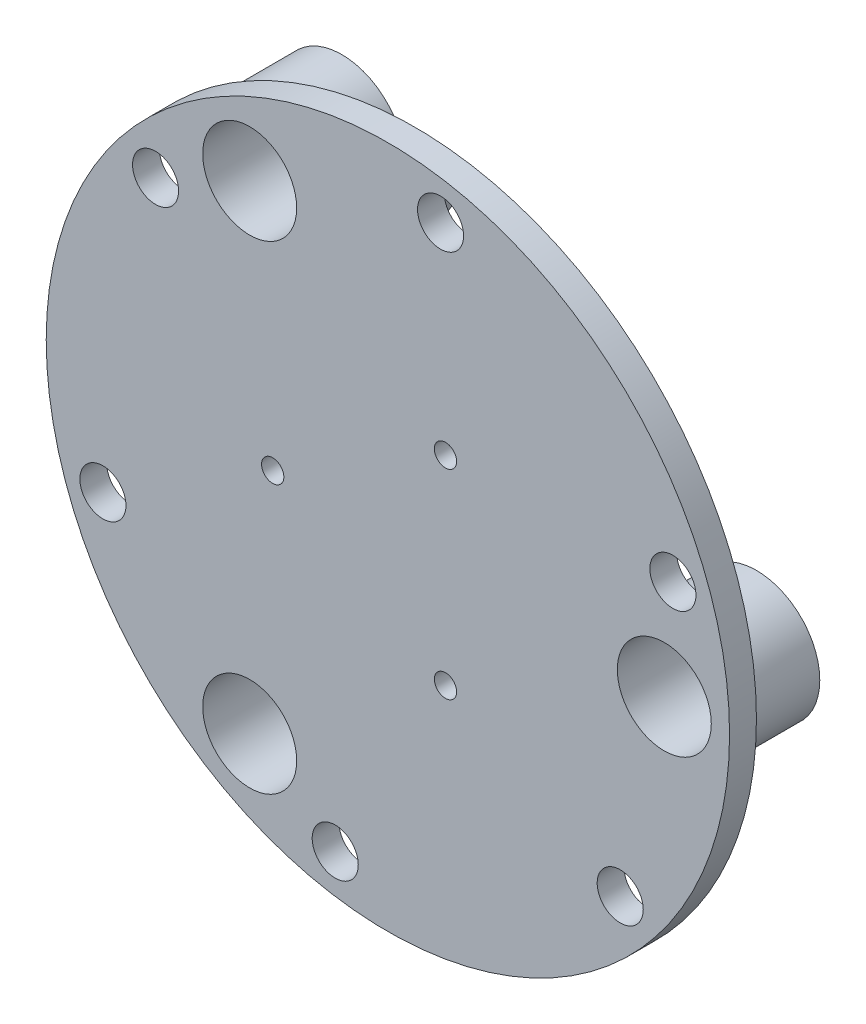
from build123d import *

# Parameters (mm, degrees)
F_01_START                                = 33.5
S01_JOINING_CENTRE_OF_FLOATING_Y_R        = 9
F_01_JOINING_CENTRE_OF_FLOATING_Y_DEPTH   = 3.5
F_02_START                                = 33.5
F_02_FLOATING_SPOKE_1_DEPTH               = 3.5
F_03_START                                = 33.5
F_03_FLOATING_SPOKE_2_DEPTH               = 3.5
F_04_START                                = 33.5
F_04_FLOATING_SPOKE_3_DEPTH               = 3.5
F_05_START                                = 33.5
F_05_MOVING_TENDON_TIE_WEB_1_DEPTH        = 3.5
F_06_START                                = 29.8
S06_TENDON_ANCHOR_BASE_1_R                = 4.2
F_06_TENDON_ANCHOR_BASE_1_DEPTH           = 3.7
F_07_START                                = 28
S07_TENDON_MOUTH_1_R                      = 3.15
F_07_TENDON_MOUTH_1_DEPTH                 = 1.8
F_08_START                                = 33.5
F_08_MOVING_TENDON_TIE_WEB_2_DEPTH        = 3.5
F_09_START                                = 29.8
S09_TENDON_ANCHOR_BASE_2_R                = 4.2
F_09_TENDON_ANCHOR_BASE_2_DEPTH           = 3.7
F_10_START                                = 28
S10_TENDON_MOUTH_2_R                      = 3.15
F_10_TENDON_MOUTH_2_DEPTH                 = 1.8
F_11_START                                = 33.5
F_11_MOVING_TENDON_TIE_WEB_3_DEPTH        = 3.5
F_12_START                                = 29.8
S12_TENDON_ANCHOR_BASE_3_R                = 4.2
F_12_TENDON_ANCHOR_BASE_3_DEPTH           = 3.7
F_13_START                                = 28
S13_TENDON_MOUTH_3_R                      = 3.15
F_13_TENDON_MOUTH_3_DEPTH                 = 1.8
F_14_START                                = 33.5
S14_JOINED_DRIVE_HOOP_R                   = 44.5
F_14_JOINED_DRIVE_HOOP_DEPTH              = 3.5
F_15_START                                = 25
S15_SLIDING_GUIDE_BARREL_1_R              = 8.25
F_15_SLIDING_GUIDE_BARREL_1_DEPTH         = 12
F_16_START                                = 25
S16_SLIDING_GUIDE_BARREL_2_R              = 8.25
F_16_SLIDING_GUIDE_BARREL_2_DEPTH         = 12
F_17_START                                = 25
S17_SLIDING_GUIDE_BARREL_3_R              = 8.25
F_17_SLIDING_GUIDE_BARREL_3_DEPTH         = 12
F_18_START                                = 24
S18_GUIDE_BUSHING_SEATS_R                 = 6.12
F_18_GUIDE_BUSHING_SEATS_DEPTH            = 14
F_19_START                                = 27.8
S19_THROUGH_TENDON_TIE_EYES_R             = 1.45
F_19_THROUGH_TENDON_TIE_EYES_DEPTH        = 10
F_20_START                                = -7.2
F_20_INTEGRAL_B1_FORK_CHEEK_L_DEPTH       = 3.6
F_21_START                                = 3.6
F_21_INTEGRAL_B1_FORK_CHEEK_R_DEPTH       = 3.6
F_22_START                                = -7.5
S22_B1_PIVOT_THROUGH_BOTH_CHEEKS_R        = 1.65
F_22_B1_PIVOT_THROUGH_BOTH_CHEEKS_DEPTH   = 15
F_23_START                                = -7.3
S23_B1_RECESSED_PIVOT_SCREW_HEAD_R        = 2.7
F_23_B1_RECESSED_PIVOT_SCREW_HEAD_DEPTH   = 1.5
F_24_START                                = -7.2
F_24_INTEGRAL_B2_FORK_CHEEK_L_DEPTH       = 3.6
F_25_START                                = 3.6
F_25_INTEGRAL_B2_FORK_CHEEK_R_DEPTH       = 3.6
F_26_START                                = -7.5
S26_B2_PIVOT_THROUGH_BOTH_CHEEKS_R        = 2.6
F_26_B2_PIVOT_THROUGH_BOTH_CHEEKS_DEPTH   = 15
F_27_START                                = -7.3
S27_B2_RECESSED_PIVOT_SCREW_HEAD_R        = 2.7
F_27_B2_RECESSED_PIVOT_SCREW_HEAD_DEPTH   = 1.5
F_28_START                                = -7.2
F_28_INTEGRAL_B3_FORK_CHEEK_L_DEPTH       = 3.6
F_29_START                                = 3.6
F_29_INTEGRAL_B3_FORK_CHEEK_R_DEPTH       = 3.6
F_30_START                                = -7.5
S30_B3_PIVOT_THROUGH_BOTH_CHEEKS_R        = 2.6
F_30_B3_PIVOT_THROUGH_BOTH_CHEEKS_DEPTH   = 15
F_31_START                                = -7.3
S31_B3_RECESSED_PIVOT_SCREW_HEAD_R        = 2.7
F_31_B3_RECESSED_PIVOT_SCREW_HEAD_DEPTH   = 1.5
CUT_EXTRUDE1_DEPTH                        = 74.425869509
CUT_EXTRUDE1_DEPTH_BACK                   = 16
SKETCH1_R                                 = 2.6
FORK_INNER_FACES_8_40_MM_LUG_CLEARANCE_BY = 0.6
FORK_INNER_FACES_8_40_MM_LUG_CLEAR_2_BY   = 0.6
FORK_INNER_FACES_8_40_MM_LUG_CLEAR_3_BY   = 0.6
FORK_INNER_FACES_8_40_MM_LUG_CLEAR_4_BY   = 0.6
FORK_INNER_FACES_8_40_MM_LUG_CLEAR_5_BY   = 0.6
FORK_INNER_FACES_8_40_MM_LUG_CLEAR_6_BY   = 0.6
SIX_START                                 = 37.1
SIX_6_MM_HOLES_ON_79_MM_PITCH_CIRCLE_R    = 3
SIX_LIGHTENING_HOLES_AT_60_DEGREES_DEPTH  = 3.7
CENTRAL_START                             = 30.55
CENTRAL_SIX_SIDED_RIB_JUNCTION_DEPTH      = 3
F_01_START_2                              = -4.12
S01_SWING_RELIEF_INSIDE_FORK_1_R          = 7.05
F_01_SWING_RELIEF_INSIDE_FORK_1_DEPTH     = 8.24
F_02_START_2                              = -4.12
S02_SWING_RELIEF_INSIDE_FORK_2_R          = 7.05
F_02_SWING_RELIEF_INSIDE_FORK_2_DEPTH     = 8.24
F_03_START_2                              = -4.12
S03_SWING_RELIEF_INSIDE_FORK_3_R          = 7.05
F_03_SWING_RELIEF_INSIDE_FORK_3_DEPTH     = 8.24


with BuildPart() as part:
    # S01 - Joining centre of floating Y → 01 - Joining centre of floating Y (new body)
    with BuildSketch(Plane.XY.offset(F_01_START)):
        Circle(S01_JOINING_CENTRE_OF_FLOATING_Y_R)
    extrude(amount=F_01_JOINING_CENTRE_OF_FLOATING_Y_DEPTH)

    # S02 - Floating spoke 1 → 02 - Floating spoke 1 (add)
    with BuildSketch(Plane.XY.offset(F_02_START)):
        with BuildLine():
            Line((4.65, -8.054036255), (-21.330762114, -23.054036255))
            ThreePointArc((-21.330762114, -23.054036255), (-34.034798369, -19.65), (-30.630762114, -6.945963745))
            Line((-30.630762114, -6.945963745), (-4.65, 8.054036255))
            ThreePointArc((-4.65, 8.054036255), (8.054036255, 4.65), (4.65, -8.054036255))
        make_face()
    extrude(amount=F_02_FLOATING_SPOKE_1_DEPTH)

    # S03 - Floating spoke 2 → 03 - Floating spoke 2 (add)
    with BuildSketch(Plane.XY.offset(F_03_START)):
        with BuildLine():
            Line((4.65, 8.054036255), (30.630762114, -6.945963745))
            ThreePointArc((30.630762114, -6.945963745), (34.034798369, -19.65), (21.330762114, -23.054036255))
            Line((21.330762114, -23.054036255), (-4.65, -8.054036255))
            ThreePointArc((-4.65, -8.054036255), (-8.054036255, 4.65), (4.65, 8.054036255))
        make_face()
    extrude(amount=F_03_FLOATING_SPOKE_2_DEPTH)

    # S04 - Floating spoke 3 → 04 - Floating spoke 3 (add)
    with BuildSketch(Plane.XY.offset(F_04_START)):
        with BuildLine():
            Line((-9.3, 0), (-9.3, 30))
            ThreePointArc((-9.3, 30), (0, 39.3), (9.3, 30))
            Line((9.3, 30), (9.3, 0))
            ThreePointArc((9.3, 0), (0, -9.3), (-9.3, 0))
        make_face()
    extrude(amount=F_04_FLOATING_SPOKE_3_DEPTH)

    # S05 - Moving tendon tie web 1 → 05 - Moving tendon tie web 1 (add)
    with BuildSketch(Plane.XY.offset(F_05_START)):
        with BuildLine():
            Line((25.299707774, -21.263079513), (6.818945661, -19.25346057))
            ThreePointArc((6.818945661, -19.25346057), (1.236920487, -12.309326717), (8.181054339, -6.727301544))
            Line((8.181054339, -6.727301544), (26.661816453, -8.736920487))
            ThreePointArc((26.661816453, -8.736920487), (32.243841627, -15.681054339), (25.299707774, -21.263079513))
        make_face()
    extrude(amount=F_05_MOVING_TENDON_TIE_WEB_1_DEPTH)

    # S06 - Tendon anchor base 1 → 06 - Tendon anchor base 1 (add)
    with BuildSketch(Plane.XY.offset(F_06_START)):
        with Locations((7.5, -12.990381057)):
            Circle(S06_TENDON_ANCHOR_BASE_1_R)
    extrude(amount=F_06_TENDON_ANCHOR_BASE_1_DEPTH)

    # S07 - Tendon mouth 1 → 07 - Tendon mouth 1 (add)
    with BuildSketch(Plane.XY.offset(F_07_START)):
        with Locations((7.5, -12.990381057)):
            Circle(S07_TENDON_MOUTH_1_R)
    extrude(amount=F_07_TENDON_MOUTH_1_DEPTH)

    # S08 - Moving tendon tie web 2 → 08 - Moving tendon tie web 2 (add)
    with BuildSketch(Plane.XY.offset(F_08_START)):
        with BuildLine():
            Line((5.764513134, 32.541729397), (13.264513134, 15.532110454))
            ThreePointArc((13.264513134, 15.532110454), (10.041729397, 7.225867923), (1.735486866, 10.448651659))
            Line((1.735486866, 10.448651659), (-5.764513134, 27.458270603))
            ThreePointArc((-5.764513134, 27.458270603), (-2.541729397, 35.764513134), (5.764513134, 32.541729397))
        make_face()
    extrude(amount=F_08_MOVING_TENDON_TIE_WEB_2_DEPTH)

    # S09 - Tendon anchor base 2 → 09 - Tendon anchor base 2 (add)
    with BuildSketch(Plane.XY.offset(F_09_START)):
        with Locations((7.5, 12.990381057)):
            Circle(S09_TENDON_ANCHOR_BASE_2_R)
    extrude(amount=F_09_TENDON_ANCHOR_BASE_2_DEPTH)

    # S10 - Tendon mouth 2 → 10 - Tendon mouth 2 (add)
    with BuildSketch(Plane.XY.offset(F_10_START)):
        with Locations((7.5, 12.990381057)):
            Circle(S10_TENDON_MOUTH_2_R)
    extrude(amount=F_10_TENDON_MOUTH_2_DEPTH)

    # S11 - Moving tendon tie web 3 → 11 - Moving tendon tie web 3 (add)
    with BuildSketch(Plane.XY.offset(F_11_START)):
        with BuildLine():
            Line((-31.064220908, -11.278649884), (-20.083458795, 3.721350116))
            ThreePointArc((-20.083458795, 3.721350116), (-11.278649884, 5.083458795), (-9.916541205, -3.721350116))
            Line((-9.916541205, -3.721350116), (-20.897303319, -18.721350116))
            ThreePointArc((-20.897303319, -18.721350116), (-29.702112229, -20.083458795), (-31.064220908, -11.278649884))
        make_face()
    extrude(amount=F_11_MOVING_TENDON_TIE_WEB_3_DEPTH)

    # S12 - Tendon anchor base 3 → 12 - Tendon anchor base 3 (add)
    with BuildSketch(Plane.XY.offset(F_12_START)):
        with Locations((-15, 0)):
            Circle(S12_TENDON_ANCHOR_BASE_3_R)
    extrude(amount=F_12_TENDON_ANCHOR_BASE_3_DEPTH)

    # S13 - Tendon mouth 3 → 13 - Tendon mouth 3 (add)
    with BuildSketch(Plane.XY.offset(F_13_START)):
        with Locations((-15, 0)):
            Circle(S13_TENDON_MOUTH_3_R)
    extrude(amount=F_13_TENDON_MOUTH_3_DEPTH)

    # S14 - Joined drive hoop → 14 - Joined drive hoop (add)
    with BuildSketch(Plane.XY.offset(F_14_START)):
        Circle(S14_JOINED_DRIVE_HOOP_R)
    extrude(amount=F_14_JOINED_DRIVE_HOOP_DEPTH)

    # S15 - Sliding guide barrel 1 → 15 - Sliding guide barrel 1 (add)
    with BuildSketch(Plane.XY.offset(F_15_START)):
        with Locations((36, 0)):
            Circle(S15_SLIDING_GUIDE_BARREL_1_R)
    extrude(amount=F_15_SLIDING_GUIDE_BARREL_1_DEPTH)

    # S16 - Sliding guide barrel 2 → 16 - Sliding guide barrel 2 (add)
    with BuildSketch(Plane.XY.offset(F_16_START)):
        with Locations((-18, 31.176914536)):
            Circle(S16_SLIDING_GUIDE_BARREL_2_R)
    extrude(amount=F_16_SLIDING_GUIDE_BARREL_2_DEPTH)

    # S17 - Sliding guide barrel 3 → 17 - Sliding guide barrel 3 (add)
    with BuildSketch(Plane.XY.offset(F_17_START)):
        with Locations((-18, -31.176914536)):
            Circle(S17_SLIDING_GUIDE_BARREL_3_R)
    extrude(amount=F_17_SLIDING_GUIDE_BARREL_3_DEPTH)

    # S18 - Guide bushing seats → 18 - Guide bushing seats (cut)
    with BuildSketch(Plane.XY.offset(F_18_START)):
        with Locations((36, 0)):
            Circle(S18_GUIDE_BUSHING_SEATS_R)
        with Locations((-18, 31.176914536)):
            Circle(S18_GUIDE_BUSHING_SEATS_R)
        with Locations((-18, -31.176914536)):
            Circle(S18_GUIDE_BUSHING_SEATS_R)
    extrude(amount=F_18_GUIDE_BUSHING_SEATS_DEPTH, mode=Mode.SUBTRACT)

    # S19 - Through tendon tie eyes → 19 - Through tendon tie eyes (cut)
    with BuildSketch(Plane.XY.offset(F_19_START)):
        with Locations((7.5, -12.990381057)):
            Circle(S19_THROUGH_TENDON_TIE_EYES_R)
        with Locations((7.5, 12.990381057)):
            Circle(S19_THROUGH_TENDON_TIE_EYES_R)
        with Locations((-15, 0)):
            Circle(S19_THROUGH_TENDON_TIE_EYES_R)
    extrude(amount=F_19_THROUGH_TENDON_TIE_EYES_DEPTH, mode=Mode.SUBTRACT)

    # S20 - Integral B1 fork cheek L → 20 - Integral B1 fork cheek L (add)
    with BuildSketch(Plane(origin=(2.009618943, -7.5, 0), x_dir=(0.9659258262890683, 0.2588190451025208, 0), z_dir=(-0.2588190451025208, 0.9659258262890684, 0)).offset(F_20_START)):
        with BuildLine():
            Line((-35.077774789, -34.5), (-22.877774789, -34.5))
            Line((-22.877774789, -34.5), (-24.027774789, -28))
            ThreePointArc((-24.027774789, -28), (-28.977774789, -23.05), (-33.927774789, -28))
            Line((-33.927774789, -28), (-35.077774789, -34.5))
        make_face()
    extrude(amount=F_20_INTEGRAL_B1_FORK_CHEEK_L_DEPTH)

    # S21 - Integral B1 fork cheek R → 21 - Integral B1 fork cheek R (add)
    with BuildSketch(Plane(origin=(2.009618943, -7.5, 0), x_dir=(0.9659258262890683, 0.2588190451025208, 0), z_dir=(-0.2588190451025208, 0.9659258262890684, 0)).offset(F_21_START)):
        with BuildLine():
            Line((-35.077774789, -34.5), (-22.877774789, -34.5))
            Line((-22.877774789, -34.5), (-24.027774789, -28))
            ThreePointArc((-24.027774789, -28), (-28.977774789, -23.05), (-33.927774789, -28))
            Line((-33.927774789, -28), (-35.077774789, -34.5))
        make_face()
    extrude(amount=F_21_INTEGRAL_B1_FORK_CHEEK_R_DEPTH)

    # S22 - B1 pivot through both cheeks → 22 - B1 pivot through both cheeks (cut)
    with BuildSketch(Plane(origin=(2.009618943, -7.5, 0), x_dir=(0.9659258262890683, 0.2588190451025208, 0), z_dir=(-0.2588190451025208, 0.9659258262890684, 0)).offset(F_22_START)):
        with Locations((-28.977774789, -28)):
            Circle(S22_B1_PIVOT_THROUGH_BOTH_CHEEKS_R)
    extrude(amount=F_22_B1_PIVOT_THROUGH_BOTH_CHEEKS_DEPTH, mode=Mode.SUBTRACT)

    # S23 - B1 recessed pivot screw head → 23 - B1 recessed pivot screw head (cut)
    with BuildSketch(Plane(origin=(2.009618943, -7.5, 0), x_dir=(0.9659258262890683, 0.2588190451025208, 0), z_dir=(-0.2588190451025208, 0.9659258262890684, 0)).offset(F_23_START)):
        with Locations((-28.977774789, -28)):
            Circle(S23_B1_RECESSED_PIVOT_SCREW_HEAD_R)
    extrude(amount=F_23_B1_RECESSED_PIVOT_SCREW_HEAD_DEPTH, mode=Mode.SUBTRACT)

    # S24 - Integral B2 fork cheek L → 24 - Integral B2 fork cheek L (add)
    with BuildSketch(Plane(origin=(5.490381057, 5.490381057, 0), x_dir=(0, 0, 1), z_dir=(-0.7071067811865476, -0.7071067811865475, 0)).offset(F_24_START)):
        with BuildLine():
            Line((34.5, -35.077774789), (34.5, -22.877774789))
            Line((34.5, -22.877774789), (28, -24.027774789))
            ThreePointArc((28, -24.027774789), (23.05, -28.977774789), (28, -33.927774789))
            Line((28, -33.927774789), (34.5, -35.077774789))
        make_face()
    extrude(amount=F_24_INTEGRAL_B2_FORK_CHEEK_L_DEPTH)

    # S25 - Integral B2 fork cheek R → 25 - Integral B2 fork cheek R (add)
    with BuildSketch(Plane(origin=(5.490381057, 5.490381057, 0), x_dir=(0, 0, 1), z_dir=(-0.7071067811865476, -0.7071067811865475, 0)).offset(F_25_START)):
        with BuildLine():
            Line((34.5, -35.077774789), (34.5, -22.877774789))
            Line((34.5, -22.877774789), (28, -24.027774789))
            ThreePointArc((28, -24.027774789), (23.05, -28.977774789), (28, -33.927774789))
            Line((28, -33.927774789), (34.5, -35.077774789))
        make_face()
    extrude(amount=F_25_INTEGRAL_B2_FORK_CHEEK_R_DEPTH)

    # S26 - B2 pivot through both cheeks → 26 - B2 pivot through both cheeks (cut)
    with BuildSketch(Plane(origin=(5.490381057, 5.490381057, 0), x_dir=(0, 0, 1), z_dir=(-0.7071067811865476, -0.7071067811865475, 0)).offset(F_26_START)):
        with Locations((28, -28.977774789)):
            Circle(S26_B2_PIVOT_THROUGH_BOTH_CHEEKS_R)
    extrude(amount=F_26_B2_PIVOT_THROUGH_BOTH_CHEEKS_DEPTH, mode=Mode.SUBTRACT)

    # S27 - B2 recessed pivot screw head → 27 - B2 recessed pivot screw head (cut)
    with BuildSketch(Plane(origin=(5.490381057, 5.490381057, 0), x_dir=(0, 0, 1), z_dir=(-0.7071067811865476, -0.7071067811865475, 0)).offset(F_27_START)):
        with Locations((28, -28.977774789)):
            Circle(S27_B2_RECESSED_PIVOT_SCREW_HEAD_R)
    extrude(amount=F_27_B2_RECESSED_PIVOT_SCREW_HEAD_DEPTH, mode=Mode.SUBTRACT)

    # S28 - Integral B3 fork cheek L → 28 - Integral B3 fork cheek L (add)
    with BuildSketch(Plane(origin=(-7.5, 2.009618943, 0), x_dir=(0, 0, -1), z_dir=(0.9659258262890683, -0.25881904510252113, 0)).offset(F_28_START)):
        with BuildLine():
            Line((-34.5, 35.077774789), (-34.5, 22.877774789))
            Line((-34.5, 22.877774789), (-28, 24.027774789))
            ThreePointArc((-28, 24.027774789), (-23.05, 28.977774789), (-28, 33.927774789))
            Line((-28, 33.927774789), (-34.5, 35.077774789))
        make_face()
    extrude(amount=F_28_INTEGRAL_B3_FORK_CHEEK_L_DEPTH)

    # S29 - Integral B3 fork cheek R → 29 - Integral B3 fork cheek R (add)
    with BuildSketch(Plane(origin=(-7.5, 2.009618943, 0), x_dir=(0, 0, -1), z_dir=(0.9659258262890683, -0.25881904510252113, 0)).offset(F_29_START)):
        with BuildLine():
            Line((-34.5, 35.077774789), (-34.5, 22.877774789))
            Line((-34.5, 22.877774789), (-28, 24.027774789))
            ThreePointArc((-28, 24.027774789), (-23.05, 28.977774789), (-28, 33.927774789))
            Line((-28, 33.927774789), (-34.5, 35.077774789))
        make_face()
    extrude(amount=F_29_INTEGRAL_B3_FORK_CHEEK_R_DEPTH)

    # S30 - B3 pivot through both cheeks → 30 - B3 pivot through both cheeks (cut)
    with BuildSketch(Plane(origin=(-7.5, 2.009618943, 0), x_dir=(0, 0, -1), z_dir=(0.9659258262890683, -0.25881904510252113, 0)).offset(F_30_START)):
        with Locations((-28, 28.977774789)):
            Circle(S30_B3_PIVOT_THROUGH_BOTH_CHEEKS_R)
    extrude(amount=F_30_B3_PIVOT_THROUGH_BOTH_CHEEKS_DEPTH, mode=Mode.SUBTRACT)

    # S31 - B3 recessed pivot screw head → 31 - B3 recessed pivot screw head (cut)
    with BuildSketch(Plane(origin=(-7.5, 2.009618943, 0), x_dir=(0, 0, -1), z_dir=(0.9659258262890683, -0.25881904510252113, 0)).offset(F_31_START)):
        with Locations((-28, 28.977774789)):
            Circle(S31_B3_RECESSED_PIVOT_SCREW_HEAD_R)
    extrude(amount=F_31_B3_RECESSED_PIVOT_SCREW_HEAD_DEPTH, mode=Mode.SUBTRACT)

    # Sketch1 → Cut-Extrude1 (cut, two sides: drawn at the far end of the back side and taken through both)
    with BuildSketch(Plane(origin=(0.146121818, -0.545334051, 0), x_dir=(0.9659258262890683, 0.25881904510252085, 0), z_dir=(-0.2588190451025208, 0.9659258262890682, 0)).offset(-CUT_EXTRUDE1_DEPTH_BACK)):
        with Locations((-28.977774789, -28)):
            Circle(SKETCH1_R)
    extrude(amount=CUT_EXTRUDE1_DEPTH + CUT_EXTRUDE1_DEPTH_BACK, mode=Mode.SUBTRACT)

    # Fork inner faces - 8.40 mm lug clearance: a face moved inward by 0.6
    extrude(part.faces().sort_by_distance((-25.049013551, -18.477332975, 30.8875))[0], amount=FORK_INNER_FACES_8_40_MM_LUG_CLEARANCE_BY, dir=(0.258819045, -0.965925826, 0), mode=Mode.SUBTRACT)

    # Fork inner faces - 8.40 mm lug clear 2: a face moved inward by 0.6
    extrude(part.faces().sort_by_distance((-26.912510676, -11.522667025, 30.8875))[0], amount=FORK_INNER_FACES_8_40_MM_LUG_CLEAR_2_BY, dir=(-0.258819045, 0.965925826, 0), mode=Mode.SUBTRACT)

    # Fork inner faces - 8.40 mm lug clear 3: a face moved inward by 0.6
    extrude(part.faces().sort_by_distance((30.620470455, -14.548539517, 28.275))[0], amount=FORK_INNER_FACES_8_40_MM_LUG_CLEAR_3_BY, dir=(0.707106781, 0.707106781, 0), mode=Mode.SUBTRACT)

    # Fork inner faces - 8.40 mm lug clear 4: a face moved inward by 0.6
    extrude(part.faces().sort_by_distance((25.52930163, -19.639708341, 28.275))[0], amount=FORK_INNER_FACES_8_40_MM_LUG_CLEAR_4_BY, dir=(-0.707106781, -0.707106781, 0), mode=Mode.SUBTRACT)

    # Fork inner faces - 8.40 mm lug clear 5: a face moved inward by 0.6
    extrude(part.faces().sort_by_distance((-4.243835531, 28.071122077, 28.275))[0], amount=FORK_INNER_FACES_8_40_MM_LUG_CLEAR_5_BY, dir=(-0.965925826, 0.258819045, 0), mode=Mode.SUBTRACT)

    # Fork inner faces - 8.40 mm lug clear 6: a face moved inward by 0.6
    extrude(part.faces().sort_by_distance((2.710830418, 26.207624952, 28.275))[0], amount=FORK_INNER_FACES_8_40_MM_LUG_CLEAR_6_BY, dir=(0.965925826, -0.258819045, 0), mode=Mode.SUBTRACT)

    # Six 6 mm holes on 79 mm pitch circle → Six lightening holes at 60 degrees (cut)
    with BuildSketch(Plane.XY.offset(SIX_START)):
        with Locations((37.117858521, 13.509795661)):
            Circle(SIX_6_MM_HOLES_ON_79_MM_PITCH_CIRCLE_R)
        with Locations((6.859103018, 38.899906244)):
            Circle(SIX_6_MM_HOLES_ON_79_MM_PITCH_CIRCLE_R)
        with Locations((-30.258755503, 25.390110583)):
            Circle(SIX_6_MM_HOLES_ON_79_MM_PITCH_CIRCLE_R)
        with Locations((-37.117858521, -13.509795661)):
            Circle(SIX_6_MM_HOLES_ON_79_MM_PITCH_CIRCLE_R)
        with Locations((-6.859103018, -38.899906244)):
            Circle(SIX_6_MM_HOLES_ON_79_MM_PITCH_CIRCLE_R)
        with Locations((30.258755503, -25.390110583)):
            Circle(SIX_6_MM_HOLES_ON_79_MM_PITCH_CIRCLE_R)
    extrude(amount=-SIX_LIGHTENING_HOLES_AT_60_DEGREES_DEPTH, mode=Mode.SUBTRACT)

    # Central hub - 11 mm across flats → Central six-sided rib junction (add)
    with BuildSketch(Plane.XY.offset(CENTRAL_START)):
        Polygon((5.5, 3.175426481), (0, 6.350852961), (-5.5, 3.175426481), (-5.5, -3.175426481), (0, -6.350852961), (5.5, -3.175426481), align=None)
    extrude(amount=CENTRAL_SIX_SIDED_RIB_JUNCTION_DEPTH)

    # Guide 1 radial trapezoidal rib - root → Guide 1 radial trapezoidal rib section 0
    with BuildSketch(Plane(origin=(4.85, -2.25, 33.55), x_dir=(0, 0.8011814241315997, -0.5984215283781675), z_dir=(1, 0, 0))):
        with BuildLine():
            Line((0, 0), (3.605316409, 2.692896878))
            Line((3.605316409, 2.692896878), (4.96305674, 0))
            Line((4.96305674, 0), (2.196883547, -2.066120782))
            Line((2.196883547, -2.066120782), (0, 0))
        make_face()
    # Guide 1 radial trapezoidal rib - tip → Guide 1 radial trapezoidal rib section 1
    with BuildSketch(Plane(origin=(29.15, -2.7, 33.55), x_dir=(0, 0.5044526883330976, -0.8634393350047882), z_dir=(1, 0, 0))):
        with BuildLine():
            Line((0, 0), (2.724044517, 4.662572409))
            Line((2.724044517, 4.662572409), (8.222928597, 0))
            Line((8.222928597, 0), (6.761954477, -2.500655765))
            Line((6.761954477, -2.500655765), (0, 0))
        make_face()
    loft()

    # Tendon 1 radial trapezoidal rib - root → Tendon 1 radial trapezoidal rib section 0
    with BuildSketch(Plane(origin=(4.027146997, 3.275223208, 33.55), x_dir=(-0.6325712569152563, 0.36521518546164355, -0.6829871691568372), z_dir=(0.5000000000000003, 0.8660254037844385, 0))):
        with BuildLine():
            Line((0, 0), (2.702592372, 2.527052526))
            Line((2.702592372, 2.527052526), (4.348544357, 0))
            Line((4.348544357, 0), (2.410991801, -1.811703877))
            Line((2.410991801, -1.811703877), (0, 0))
        make_face()
    # Tendon 1 radial trapezoidal rib - tip → Tendon 1 radial trapezoidal rib section 1
    with BuildSketch(Plane(origin=(7.770448267, 9.658811196, 33.55), x_dir=(-0.6024162615456616, 0.34780519076759553, -0.7184192349182097), z_dir=(0.4999999999999997, 0.8660254037844388, 0))):
        with BuildLine():
            Line((0, 0), (2.64331945, 2.729993093))
            Line((2.64331945, 2.729993093), (4.621257114, 0))
            Line((4.621257114, 0), (2.792366056, -1.888859841))
            Line((2.792366056, -1.888859841), (0, 0))
        make_face()
    loft()

    # Guide 2 radial trapezoidal rib - root → Guide 2 radial trapezoidal rib section 0
    with BuildSketch(Plane(origin=(-0.476442841, 5.325223208, 33.55), x_dir=(-0.6938434663381602, -0.40059071206579977, -0.5984215283781676), z_dir=(-0.49999999999999983, 0.8660254037844387, 0))):
        with BuildLine():
            Line((0, 0), (3.605316409, 2.692896878))
            Line((3.605316409, 2.692896878), (4.96305674, 0))
            Line((4.96305674, 0), (2.196883547, -2.066120782))
            Line((2.196883547, -2.066120782), (0, 0))
        make_face()
    # Guide 2 radial trapezoidal rib - tip → Guide 2 radial trapezoidal rib section 1
    with BuildSketch(Plane(origin=(-12.23673141, 26.59464052, 33.55), x_dir=(-0.4368688431038167, -0.25222634416654865, -0.8634393350047881), z_dir=(-0.4999999999999996, 0.8660254037844389, 0))):
        with BuildLine():
            Line((0, 0), (2.724044517, 4.662572409))
            Line((2.724044517, 4.662572409), (8.222928597, 0))
            Line((8.222928597, 0), (6.761954477, -2.500655765))
            Line((6.761954477, -2.500655765), (0, 0))
        make_face()
    loft()

    # Tendon 2 radial trapezoidal rib - root → Tendon 2 radial trapezoidal rib section 0
    with BuildSketch(Plane(origin=(-4.85, 1.85, 33.55), x_dir=(0, -0.7304303709232866, -0.6829871691568371), z_dir=(-1, 0, 0))):
        with BuildLine():
            Line((0, 0), (2.702592372, 2.527052526))
            Line((2.702592372, 2.527052526), (4.348544357, 0))
            Line((4.348544357, 0), (2.410991801, -1.811703877))
            Line((2.410991801, -1.811703877), (0, 0))
        make_face()
    # Tendon 2 radial trapezoidal rib - tip → Tendon 2 radial trapezoidal rib section 1
    with BuildSketch(Plane(origin=(-12.25, 1.9, 33.55), x_dir=(0, -0.6956103815351913, -0.7184192349182096), z_dir=(-1, 0, 0))):
        with BuildLine():
            Line((0, 0), (2.64331945, 2.729993093))
            Line((2.64331945, 2.729993093), (4.621257114, 0))
            Line((4.621257114, 0), (2.792366056, -1.888859841))
            Line((2.792366056, -1.888859841), (0, 0))
        make_face()
    loft()

    # Guide 3 radial trapezoidal rib - root → Guide 3 radial trapezoidal rib section 0
    with BuildSketch(Plane(origin=(-4.373557159, -3.075223208, 33.55), x_dir=(0.69384346633816, -0.4005907120658002, -0.5984215283781676), z_dir=(-0.5000000000000004, -0.8660254037844385, 0))):
        with BuildLine():
            Line((0, 0), (3.605316409, 2.692896878))
            Line((3.605316409, 2.692896878), (4.96305674, 0))
            Line((4.96305674, 0), (2.196883547, -2.066120782))
            Line((2.196883547, -2.066120782), (0, 0))
        make_face()
    # Guide 3 radial trapezoidal rib - tip → Guide 3 radial trapezoidal rib section 1
    with BuildSketch(Plane(origin=(-16.91326859, -23.89464052, 33.55), x_dir=(0.4368688431038163, -0.25222634416654915, -0.8634393350047881), z_dir=(-0.5000000000000009, -0.8660254037844382, 0))):
        with BuildLine():
            Line((0, 0), (2.724044517, 4.662572409))
            Line((2.724044517, 4.662572409), (8.222928597, 0))
            Line((8.222928597, 0), (6.761954477, -2.500655765))
            Line((6.761954477, -2.500655765), (0, 0))
        make_face()
    loft()

    # Tendon 3 radial trapezoidal rib - root → Tendon 3 radial trapezoidal rib section 0
    with BuildSketch(Plane(origin=(0.822853003, -5.125223208, 33.55), x_dir=(0.6325712569152565, 0.36521518546164344, -0.6829871691568372), z_dir=(0.5000000000000003, -0.8660254037844385, 0))):
        with BuildLine():
            Line((0, 0), (2.702592372, 2.527052526))
            Line((2.702592372, 2.527052526), (4.348544357, 0))
            Line((4.348544357, 0), (2.410991801, -1.811703877))
            Line((2.410991801, -1.811703877), (0, 0))
        make_face()
    # Tendon 3 radial trapezoidal rib - tip → Tendon 3 radial trapezoidal rib section 1
    with BuildSketch(Plane(origin=(4.479551733, -11.558811196, 33.55), x_dir=(0.6024162615456616, 0.34780519076759553, -0.7184192349182097), z_dir=(0.4999999999999997, -0.8660254037844388, 0))):
        with BuildLine():
            Line((0, 0), (2.64331945, 2.729993093))
            Line((2.64331945, 2.729993093), (4.621257114, 0))
            Line((4.621257114, 0), (2.792366056, -1.888859841))
            Line((2.792366056, -1.888859841), (0, 0))
        make_face()
    loft()

    # S01 - Swing relief inside fork 1 → 01 - Swing relief inside fork 1 (cut)
    with BuildSketch(Plane(origin=(2.009618948, -7.500000009, 0), x_dir=(-0.9659258262182564, -0.25881904536679434, 0), z_dir=(0.25881904536679434, -0.9659258262182565, 0)).offset(F_01_START_2)):
        with Locations((28.977774789, -27.999999999)):
            Circle(S01_SWING_RELIEF_INSIDE_FORK_1_R)
    extrude(amount=F_01_SWING_RELIEF_INSIDE_FORK_1_DEPTH, mode=Mode.SUBTRACT)

    # S02 - Swing relief inside fork 2 → 02 - Swing relief inside fork 2 (cut)
    with BuildSketch(Plane(origin=(5.490381051, 5.490381046, 0), x_dir=(0, 0, -1), z_dir=(0.707106781501804, 0.7071067808712911, 0)).offset(F_02_START_2)):
        with Locations((-28.000000004, -28.977774794)):
            Circle(S02_SWING_RELIEF_INSIDE_FORK_2_R)
    extrude(amount=F_02_SWING_RELIEF_INSIDE_FORK_2_DEPTH, mode=Mode.SUBTRACT)

    # S03 - Swing relief inside fork 3 → 03 - Swing relief inside fork 3 (cut)
    with BuildSketch(Plane(origin=(-7.499999999, 2.009618944, 0), x_dir=(0, 0, 1), z_dir=(-0.9659258262650057, 0.2588190451923237, 0)).offset(F_03_START_2)):
        with Locations((28.000000003, 28.977774796)):
            Circle(S03_SWING_RELIEF_INSIDE_FORK_3_R)
    extrude(amount=F_03_SWING_RELIEF_INSIDE_FORK_3_DEPTH, mode=Mode.SUBTRACT)


solid = part.part
